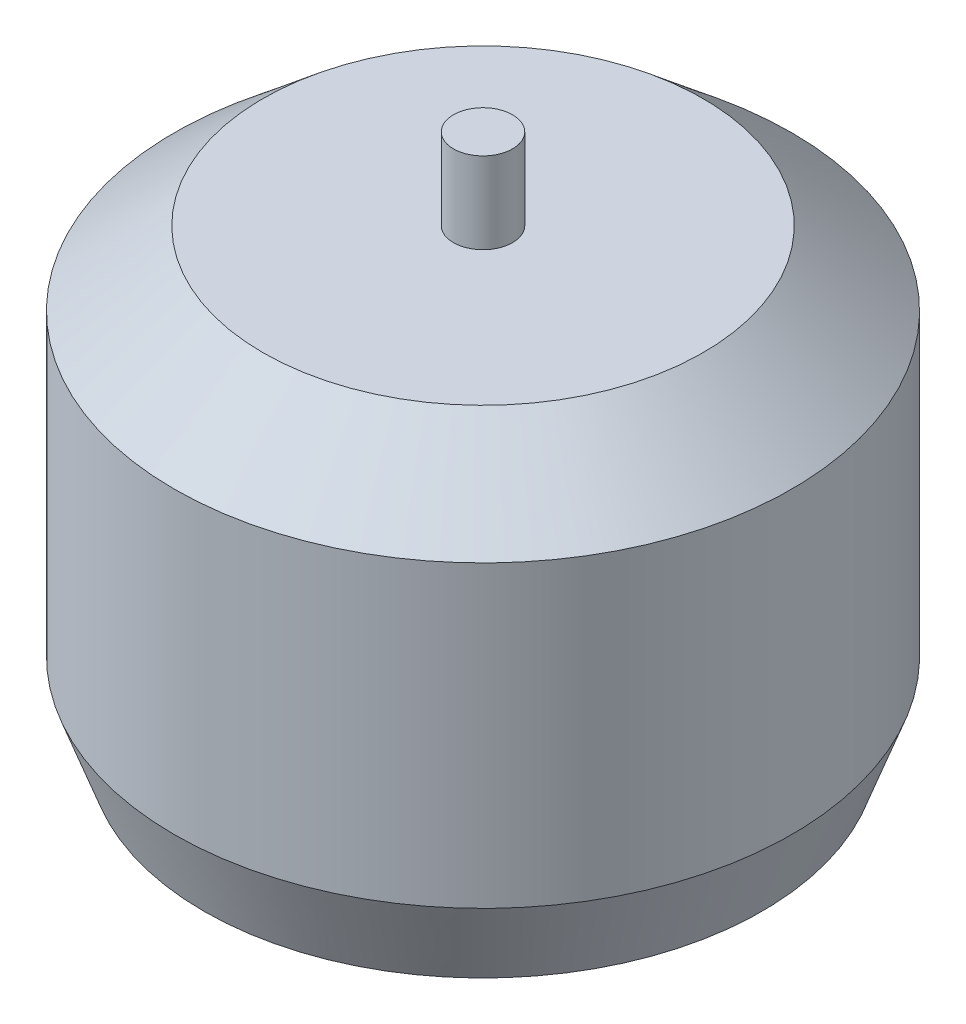
from build123d import *

# Parameters (mm, degrees)
SKETCH1_R           = 20.9
BOSS_EXTRUDE1_DEPTH = 30.75
CHAMFER1_SIZE       = 5
CHAMFER1_SIZE2      = 6
CHAMFER2_SIZE       = 2
CHAMFER2_SIZE2      = 5.494954839
SKETCH2_R           = 2
BOSS_EXTRUDE2_DEPTH = 5.5
SKETCH3_R           = 4
BOSS_EXTRUDE3_DEPTH = 2.55
SKETCH4_R           = 4
SKETCH4_R_2         = 1
CUT_EXTRUDE1_DEPTH  = 1.5875


with BuildPart() as part:
    # Sketch1 → Boss-Extrude1 (new body)
    with BuildSketch(Plane(origin=(0, 0, 0), x_dir=(1, 0, 0), z_dir=(0, 1, 0))):
        with Locations((-5.649057894, -5.328088696)):
            Circle(SKETCH1_R)
    extrude(amount=BOSS_EXTRUDE1_DEPTH)

    # Chamfer1
    chamfer1_edges = [part.edges().sort_by_distance(p)[0] for p in [
        (-26.549057894, 30.75, 5.328088696),
    ]]
    chamfer1_side = [part.faces().sort_by_distance(p)[0] for p in [
        (-26.549057894, 15.375, 5.328088696),
    ]]
    chamfer(chamfer1_edges, length=CHAMFER1_SIZE, length2=CHAMFER1_SIZE2, reference=chamfer1_side[0])

    # Chamfer2
    chamfer2_edges = [part.edges().sort_by_distance(p)[0] for p in [
        (-26.549057894, 0, 5.328088696),
    ]]
    chamfer2_side = [part.faces().sort_by_distance(p)[0] for p in [
        (-5.649057894, 0, 5.328088696),
    ]]
    chamfer(chamfer2_edges, length=CHAMFER2_SIZE, length2=CHAMFER2_SIZE2, reference=chamfer2_side[0])

    # Sketch2 → Boss-Extrude2 (add)
    with BuildSketch(Plane(origin=(0, 30.75, 0), x_dir=(1, 0, 0), z_dir=(0, 1, 0))):
        with Locations((-5.649057894, -5.328088696)):
            Circle(SKETCH2_R)
    extrude(amount=BOSS_EXTRUDE2_DEPTH)

    # Sketch3 → Boss-Extrude3 (add)
    with BuildSketch(Plane.XZ):
        with Locations((-5.649057894, 5.328088696)):
            Circle(SKETCH3_R)
    extrude(amount=BOSS_EXTRUDE3_DEPTH)

    # Sketch4 → Cut-Extrude1 (cut)
    with BuildSketch(Plane.XZ):
        with Locations((-5.908658192, 17.486035989)):
            Circle(SKETCH4_R)
        with Locations((-5.908658192, -6.829858597)):
            Circle(SKETCH4_R)
        with Locations((-17.807005187, 5.587688994)):
            Circle(SKETCH4_R)
        with Locations((5.989688802, 5.587688994)):
            Circle(SKETCH4_R)
        with Locations((-12.366572316, 12.045603117)):
            Circle(SKETCH4_R_2)
        with Locations((1.068456527, -1.389425725)):
            Circle(SKETCH4_R_2)
        with Locations((-11.305912144, -0.328765554)):
            Circle(SKETCH4_R_2)
        with Locations((0.007796355, 10.984942945)):
            Circle(SKETCH4_R_2)
        with Locations((-14.487892659, -3.510746069)):
            Circle(SKETCH4_R_2)
        with Locations((3.18977687, 14.166923461)):
            Circle(SKETCH4_R_2)
    extrude(amount=-CUT_EXTRUDE1_DEPTH, mode=Mode.SUBTRACT)


solid = part.part
